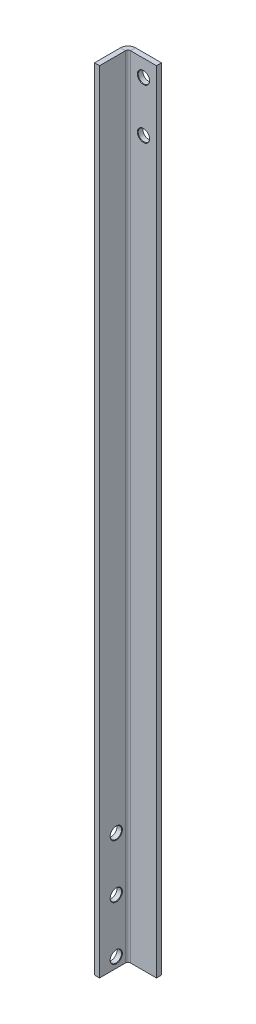
from build123d import *

# Parameters (mm, degrees)
BASE_FLANGE1_DEPTH            = 118
M3_CLEARANCE_HOLE1_AT_2_COUNT = 2
M3_CLEARANCE_HOLE1_AT_2_PITCH = 15
M3_CLEARANCE_HOLE2_AT_2_COUNT = 2
M3_CLEARANCE_HOLE2_AT_2_PITCH = 16
M3_CLEARANCE_HOLE2_AT_3_COUNT = 2
M3_CLEARANCE_HOLE2_AT_3_PITCH = 32


# Sheet-metal steps are written as plain solids
with BuildPart() as part:
    # Sketch1 → Base-Flange1 (new, symmetric)
    with BuildSketch(Plane(origin=(0, 0, 0), x_dir=(1, 0, 0), z_dir=(0, 1, 0))):
        with BuildLine():
            Line((0, -10), (0, -2.2366))
            ThreePointArc((0, -2.2366), (0.655084973, -0.655084973), (2.2366, 0))
            Line((2.2366, 0), (10, 0))
            Line((10, 0), (10, -1.5))
            Line((10, -1.5), (2.2366, -1.5))
            ThreePointArc((2.2366, -1.5), (1.715745145, -1.715745145), (1.5, -2.2366))
            Line((1.5, -2.2366), (1.5, -10))
            Line((1.5, -10), (0, -10))
        make_face()
    extrude(amount=BASE_FLANGE1_DEPTH, both=True)

    # Sketch9 → M3 Clearance Hole1 (revolve, cut)
    with BuildSketch(Plane(origin=(6.1183, 113, 1.5), x_dir=(0, -1, 0), z_dir=(1, 0, 0))):
        Polygon((0, 0), (0, 1.5), (1.7, 1.5), (1.7, 0.125), (1.825, 0), align=None)
    m3_clearance_hole1 = revolve(axis=Axis((6.1183, 113, 7.85), (0, 0, -1)), mode=Mode.SUBTRACT)

    # M3 Clearance Hole1 at 2: M3 Clearance Hole1 ×2
    with Locations(*[(0, -i * M3_CLEARANCE_HOLE1_AT_2_PITCH, 0) for i in range(1, M3_CLEARANCE_HOLE1_AT_2_COUNT)]):
        add(m3_clearance_hole1, mode=Mode.SUBTRACT)

    # Sketch12 → M3 Clearance Hole2 (revolve, cut)
    with BuildSketch(Plane(origin=(1.5, -115, 5), x_dir=(0, 0, -1), z_dir=(0, 1, 0))):
        Polygon((0, 0), (0, 1.5), (1.7, 1.5), (1.7, 0.125), (1.825, 0), align=None)
    m3_clearance_hole2 = revolve(axis=Axis((7.85, -115, 5), (-1, 0, 0)), mode=Mode.SUBTRACT)

    # M3 Clearance Hole2 at 2: M3 Clearance Hole2 ×2
    with Locations(*[(0, i * M3_CLEARANCE_HOLE2_AT_2_PITCH, 0) for i in range(1, M3_CLEARANCE_HOLE2_AT_2_COUNT)]):
        add(m3_clearance_hole2, mode=Mode.SUBTRACT)

    # M3 Clearance Hole2 at 3: M3 Clearance Hole2 ×2
    with Locations(*[(0, i * M3_CLEARANCE_HOLE2_AT_3_PITCH, 0) for i in range(1, M3_CLEARANCE_HOLE2_AT_3_COUNT)]):
        add(m3_clearance_hole2, mode=Mode.SUBTRACT)


solid = part.part
